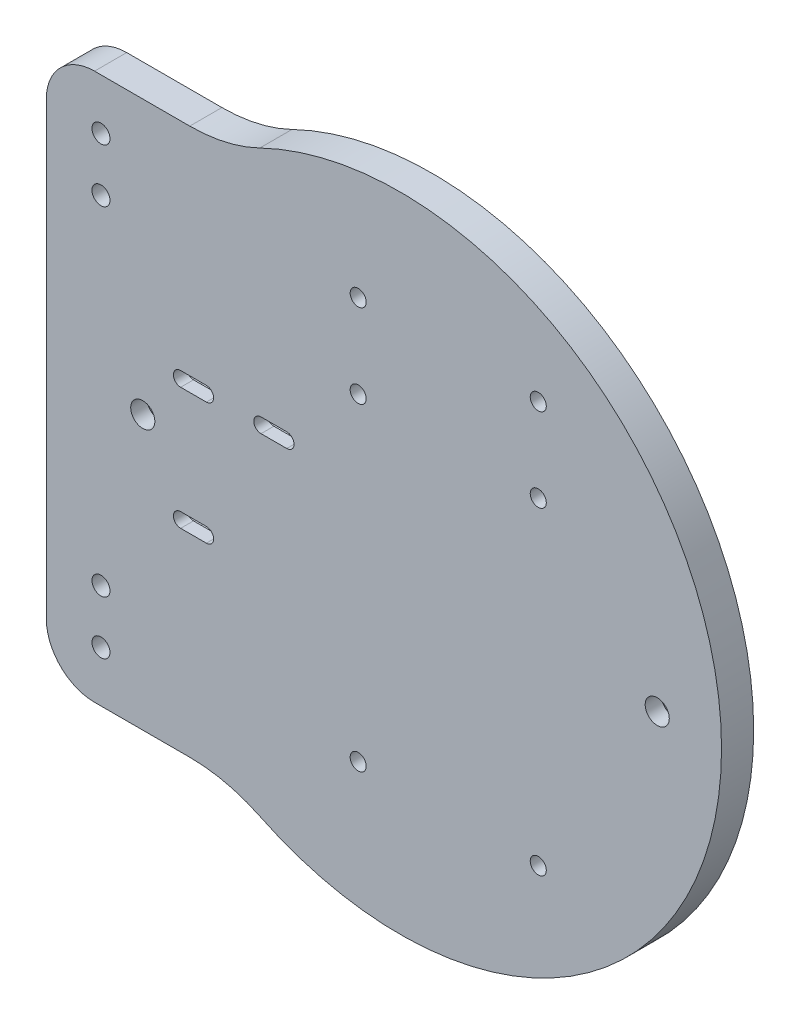
from build123d import *

# Parameters (mm, degrees)
SALIENTE_EXTRUIR2_DEPTH                              = 10
REDONDEO3_R                                          = 15
REDONDEO5_R                                          = 50
CROQUIS4_R                                           = 2.8
CROQUIS4_R_2                                         = 2.5
CORTAR_EXTRUIR1_DEPTH                                = 149.996644258
REFRENTADO_PARA_TORNILLO_CON_CABEZA_TRON_D           = 4.5
REFRENTADO_PARA_TORNILLO_CON_CABEZA_TRON_CBORE_D     = 7.5
REFRENTADO_PARA_TORNILLO_CON_CABEZA_TRON_CBORE_DEPTH = 5
CORTAR_EXTRUIR2_DEPTH                                = 6


with BuildPart() as part:
    # Croquis2 → Saliente-Extruir2 (new body)
    with BuildSketch(Plane(origin=(0, 0, 0), x_dir=(0, 1, 0), z_dir=(0, 0, 1))):
        with BuildLine():
            Line((-85, 52.678268764), (-85, 110))
            Line((-85, 110), (85, 110))
            Line((85, 110), (85, 52.678268764))
            ThreePointArc((85, 52.678268764), (0, -100), (-85, 52.678268764))
        make_face()
    extrude(amount=SALIENTE_EXTRUIR2_DEPTH)

    # Redondeo3
    redondeo3_edges = [part.edges().sort_by_distance(p)[0] for p in [
        (-110, 85, 5),
        (-110, -85, 5),
    ]]
    fillet(redondeo3_edges, radius=REDONDEO3_R)

    # Redondeo5
    redondeo5_edges = [part.edges().sort_by_distance(p)[0] for p in [
        (-52.678268764, 85, 5),
        (-52.678268764, -85, 5),
    ]]
    fillet(redondeo5_edges, radius=REDONDEO5_R)

    # Croquis4 → Cortar-Extruir1 (cut, through all)
    with BuildSketch(Plane.XY.offset(10)):
        with Locations((-93, 69.2)):
            Circle(CROQUIS4_R)
        with Locations((-93, 52.559880358)):
            Circle(CROQUIS4_R)
        with Locations((-93, -52.559880358)):
            Circle(CROQUIS4_R)
        with Locations((-93, -69.2)):
            Circle(CROQUIS4_R)
        with Locations((-13, 39)):
            Circle(CROQUIS4_R_2)
        with Locations((43, 39)):
            Circle(CROQUIS4_R_2)
        with Locations((-13, 65)):
            Circle(CROQUIS4_R_2)
        with Locations((43, 65)):
            Circle(CROQUIS4_R_2)
        with Locations((-13, -60)):
            Circle(CROQUIS4_R_2)
        with Locations((43, -60)):
            Circle(CROQUIS4_R_2)
        with BuildLine():
            Line((-60.219532094, 13.25), (-68.219532094, 13.25))
            ThreePointArc((-68.219532094, 13.25), (-70.469532094, 15.5), (-68.219532094, 17.75))
            Line((-68.219532094, 17.75), (-60.219532094, 17.75))
            ThreePointArc((-60.219532094, 17.75), (-57.969532094, 15.5), (-60.219532094, 13.25))
        make_face()
        with BuildLine():
            Line((-35.219532094, 13.25), (-43.219532094, 13.25))
            ThreePointArc((-43.219532094, 13.25), (-45.469532094, 15.5), (-43.219532094, 17.75))
            Line((-43.219532094, 17.75), (-35.219532094, 17.75))
            ThreePointArc((-35.219532094, 17.75), (-32.969532094, 15.5), (-35.219532094, 13.25))
        make_face()
        with BuildLine():
            Line((-60.219532094, -24.75), (-68.219532094, -24.75))
            ThreePointArc((-68.219532094, -24.75), (-70.469532094, -22.5), (-68.219532094, -20.25))
            Line((-68.219532094, -20.25), (-60.219532094, -20.25))
            ThreePointArc((-60.219532094, -20.25), (-57.969532094, -22.5), (-60.219532094, -24.75))
        make_face()
    extrude(amount=-CORTAR_EXTRUIR1_DEPTH, mode=Mode.SUBTRACT)

    # Refrentado para tornillo con cabeza troncocónica de M41 (through all)
    with Locations(Plane.XY.offset(10)):
        with Locations((-80, 0), (80, 0)):
            CounterBoreHole(REFRENTADO_PARA_TORNILLO_CON_CABEZA_TRON_D / 2, REFRENTADO_PARA_TORNILLO_CON_CABEZA_TRON_CBORE_D / 2, REFRENTADO_PARA_TORNILLO_CON_CABEZA_TRON_CBORE_DEPTH)

    # Croquis7 → Cortar-Extruir2 (cut)
    with BuildSketch(Plane(origin=(0, 0, 0), x_dir=(1, 0, 0), z_dir=(0, 0, -1))):
        with BuildLine():
            Line((-68.219532094, 27), (-60.219532094, 27))
            ThreePointArc((-60.219532094, 27), (-55.719532094, 22.5), (-60.219532094, 18))
            Line((-60.219532094, 18), (-68.219532094, 18))
            ThreePointArc((-68.219532094, 18), (-72.719532094, 22.5), (-68.219532094, 27))
        make_face()
        with BuildLine():
            Line((-68.219532094, -11), (-60.219532094, -11))
            ThreePointArc((-60.219532094, -11), (-55.719532094, -15.5), (-60.219532094, -20))
            Line((-60.219532094, -20), (-68.219532094, -20))
            ThreePointArc((-68.219532094, -20), (-72.719532094, -15.5), (-68.219532094, -11))
        make_face()
        with BuildLine():
            Line((-43.219532094, -11), (-35.219532094, -11))
            ThreePointArc((-35.219532094, -11), (-30.719532094, -15.5), (-35.219532094, -20))
            Line((-35.219532094, -20), (-43.219532094, -20))
            ThreePointArc((-43.219532094, -20), (-47.719532094, -15.5), (-43.219532094, -11))
        make_face()
    extrude(amount=-CORTAR_EXTRUIR2_DEPTH, mode=Mode.SUBTRACT)


solid = part.part
